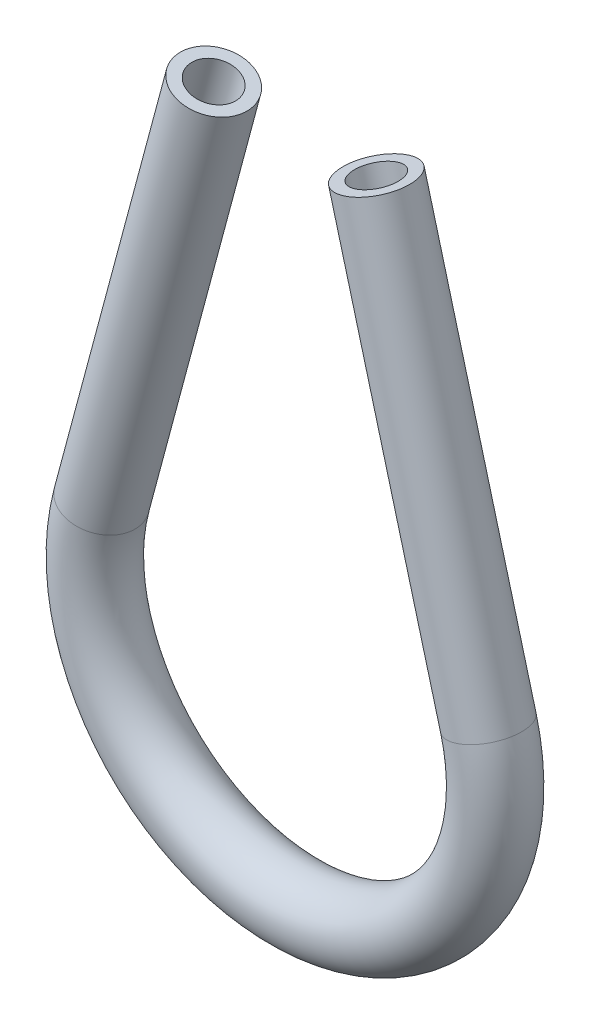
from build123d import *

# Parameters (mm, degrees)
SKETCH2_R   = 6.35
SKETCH2_R_2 = 4.1671875


with BuildPart() as part:
    # Sweep1: sweep along a path in Sketch1
    with BuildLine(Plane.XY) as sweep1_path:
        Line((-138.985158779, -15.429917513), (-159.618955177, -92.436294023))
        ThreePointArc((-159.618955177, -92.436294023), (-124.004465969, -138.85), (-88.389976761, -92.436294023))
        Line((-88.389976761, -92.436294023), (-109.023773159, -15.429917513))
    # Sketch2 → Sweep1 (sweep)
    with BuildSketch(Plane(origin=(-3.445728615, 12.859634261, 0), x_dir=(0.96592582628907, 0.25881904510251463, 0), z_dir=(0.2588190451025146, -0.9659258262890699, 0))):
        with Locations((-109.302434691, 0)):
            Circle(SKETCH2_R)
        with Locations((-109.302434691, 0)):
            Circle(SKETCH2_R_2, mode=Mode.SUBTRACT)
    sweep(path=sweep1_path.line)


solid = part.part
